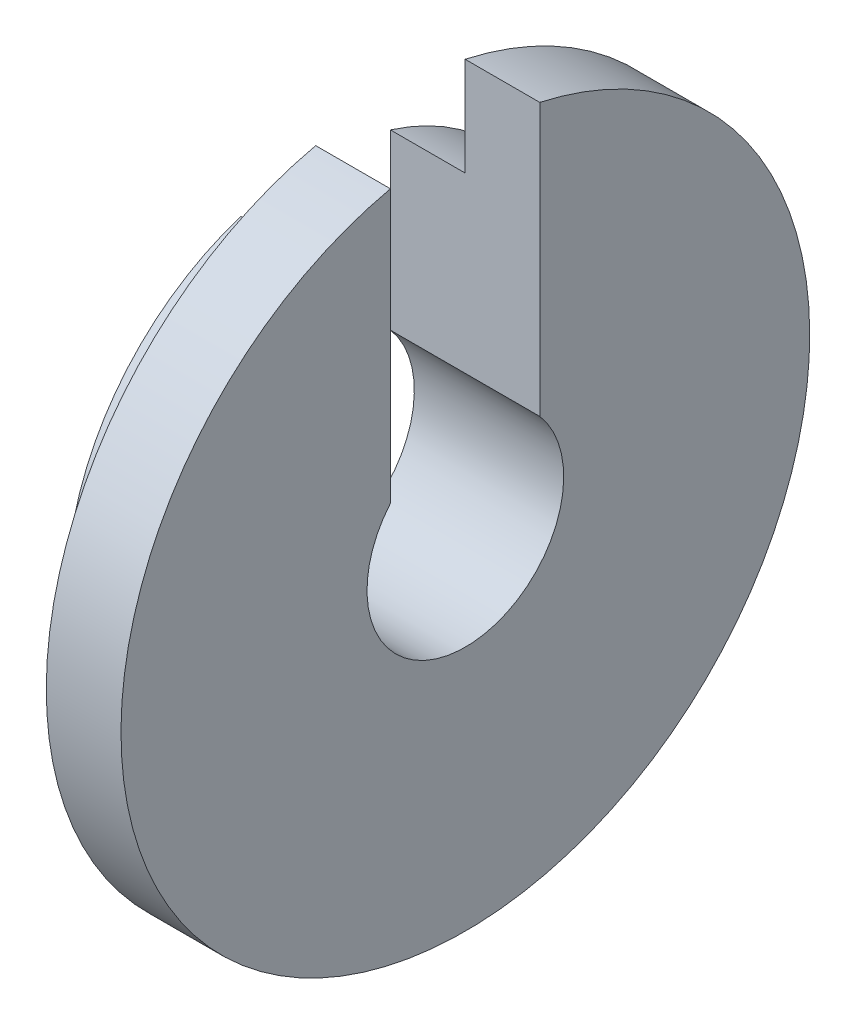
from build123d import *
from build123d.topology import SkipClean

# Parameters (mm, degrees)
BOSS_EXTRUDE1_DEPTH = 0.762
BOSS_EXTRUDE2_START = -1.524
BOSS_EXTRUDE2_DEPTH = 1.524


with BuildPart() as part:
    # Sketch1 → Boss-Extrude1 (new body)
    with BuildSketch(Plane(origin=(0, 0, 0), x_dir=(0, 0, -1), z_dir=(1, 0, 0))):
        with BuildLine():
            Line((0.759321469, 3.430139815), (0.759321469, 0.655775721))
            ThreePointArc((0.759321469, 0.655775721), (0.004117603, -1.003291551), (-0.764678531, 0.649521081))
            Line((-0.764678531, 0.649521081), (-0.764678531, 3.428949546))
            ThreePointArc((-0.764678531, 3.428949546), (0.00274385, -3.51317815), (0.759321469, 3.430139815))
        make_face()
    extrude(amount=BOSS_EXTRUDE1_DEPTH)

    # Sketch3 → Boss-Extrude2 (add)
    with SkipClean():  # the faces are left unmerged after this step: merging them gives an invalid solid
        with BuildSketch(Plane(origin=(0.762, 0, 0), x_dir=(0, 0, -1), z_dir=(1, 0, 0)).offset(BOSS_EXTRUDE2_START)):
            with BuildLine():
                Line((-0.764678531, 2.423347628), (-0.764678531, 0.649521081))
                ThreePointArc((-0.764678531, 0.649521081), (0.004117603, -1.003291551), (0.759321469, 0.655775721))
                Line((0.759321469, 0.655775721), (0.759321469, 2.425031523))
                ThreePointArc((0.759321469, 2.425031523), (0.00280774, -2.541129493), (-0.764678531, 2.423347628))
            make_face()
        extrude(amount=BOSS_EXTRUDE2_DEPTH)


solid = part.part
